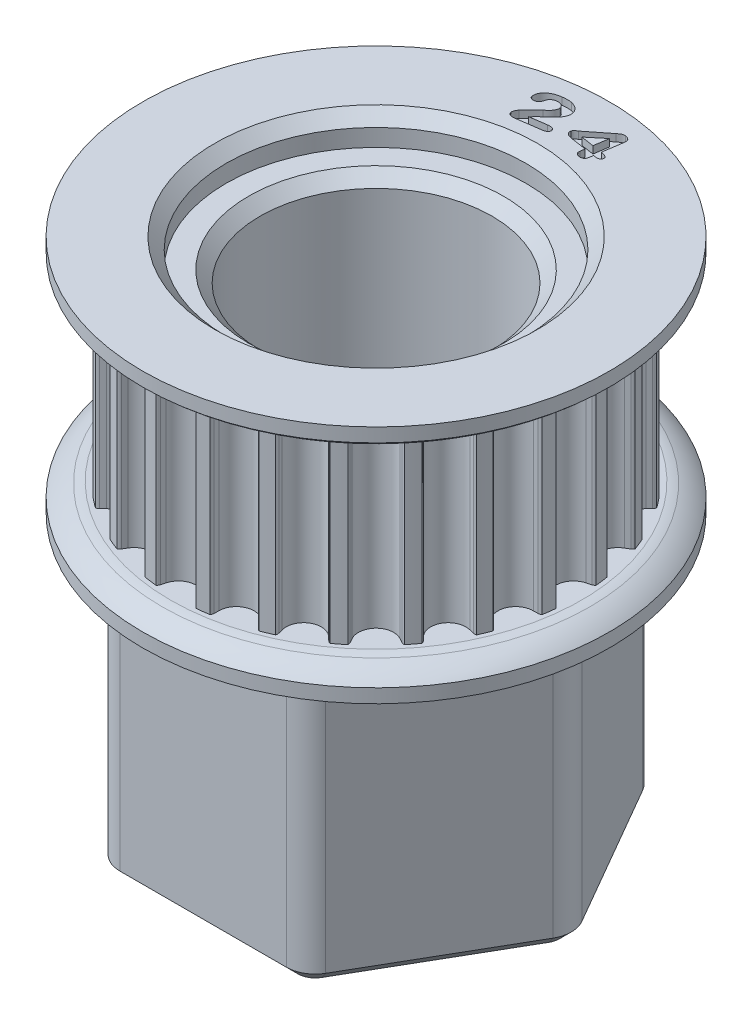
from build123d import *

# Parameters (mm, degrees)
SKETCH1_R                    = 11.078156269
TOOTHOD_DEPTH                = 5.08
TOOTHPROFILE_DEPTH           = 17.469896559
TOOTHPATTERN_COUNT           = 24
BORE_DEPTH                   = 20.343586122
BORE_DEPTH_BACK              = 20.343586122
SKETCH7_R                    = 6.3881
SMALL_TOOTH_COUNT_DEPTH      = 23.472489227
SMALL_TOOTH_COUNT_DEPTH_BACK = 0.4
SKETCH12_R                   = 6.3881
BOSS_EXTRUDE1_DEPTH          = 15.24
SKETCH27_R                   = 8.255
CUT_EXTRUDE1_DEPTH           = 1.5875
FILLET1_R                    = 1.5875
CUT_SWEEP1_PROFILE_R         = 0.3175
FILLET2_R                    = 1.27
CHAMFER1_SIZE                = 0.635
CHAMFER2_SIZE                = 0.635


with BuildPart() as part:
    # Sketch1 → ToothOD (new, symmetric)
    with BuildSketch(Plane(origin=(0, 0, 0), x_dir=(1, 0, 0), z_dir=(0, 1, 0))):
        Circle(SKETCH1_R)
    extrude(amount=TOOTHOD_DEPTH, both=True)

    # Sketch2 → ToothProfile (cut, symmetric)
    with BuildSketch(Plane(origin=(0, 0, 0), x_dir=(1, 0, 0), z_dir=(0, 1, 0))):
        with BuildLine():
            ThreePointArc((-0.937033068, 10.628218265), (-0.590385173, 10.110043655), (0, 9.909756269))
            ThreePointArc((0, 9.909756269), (0.590385173, 10.110043655), (0.937033068, 10.628218265))
            ThreePointArc((0.937033068, 10.628218265), (0.971699064, 10.754329727), (1.007805813, 10.880036269))
            ThreePointArc((1.007805813, 10.880036269), (1.043742495, 10.958436311), (1.100516181, 11.023357495))
            ThreePointArc((1.100516181, 11.023357495), (0, 11.078156269), (-1.100516181, 11.023357495))
            ThreePointArc((-1.100516181, 11.023357495), (-1.043742495, 10.958436311), (-1.007805813, 10.880036269))
            ThreePointArc((-1.007805813, 10.880036269), (-0.971699064, 10.754329727), (-0.937033068, 10.628218265))
        make_face()
    toothprofile = extrude(amount=TOOTHPROFILE_DEPTH, both=True, mode=Mode.SUBTRACT)

    # ToothPattern: ToothProfile ×24 about axis
    toothpattern_axis = Axis((0, 5.08, 0), (0, -1, 0))
    for i in range(1, TOOTHPATTERN_COUNT):
        add(toothprofile.rotate(toothpattern_axis, i * 360 / TOOTHPATTERN_COUNT), mode=Mode.SUBTRACT)

    # Sketch4 → Flange (revolve)
    with BuildSketch(Plane.XY):
        with BuildLine():
            Line((0, -5.08), (11.332156269, -5.08))
            ThreePointArc((11.332156269, -5.08), (11.56180289, -5.115951298), (11.787228598, -5.172637424))
            ThreePointArc((11.787228598, -5.172637424), (12.354957174, -5.454197125), (12.856156269, -5.842))
            Line((12.856156269, -5.842), (12.856156269, -6.604))
            Line((12.856156269, -6.604), (0, -6.604))
            Line((0, -6.604), (0, -5.08))
        make_face()
        with BuildLine():
            Line((12.856156269, 6.604), (12.856156269, 5.842))
            ThreePointArc((12.856156269, 5.842), (12.354957174, 5.454197125), (11.787228598, 5.172637424))
            ThreePointArc((11.787228598, 5.172637424), (11.56180289, 5.115951298), (11.332156269, 5.08))
            Line((11.332156269, 5.08), (0, 5.08))
            Line((0, 5.08), (0, 6.604))
            Line((0, 6.604), (12.856156269, 6.604))
        make_face()
    revolve(axis=Axis((0, 8.73125, 0), (0, -1, 0)))

    # Sketch7 → Bore (cut, two sides: drawn at the far end of the back side and taken through both)
    with BuildSketch(Plane.XZ.offset(-BORE_DEPTH_BACK)):
        Circle(SKETCH7_R)
    extrude(amount=BORE_DEPTH + BORE_DEPTH_BACK, mode=Mode.SUBTRACT)

    # Sketch11 → Small Tooth Count (cut, two sides: drawn at the far end of the back side and taken through both)
    # profile 1 of 2: a face of its own
    with BuildSketch(Plane(origin=(0, 6.604, 0), x_dir=(1, 0, 0), z_dir=(0, 1, 0)).offset(-SMALL_TOOTH_COUNT_DEPTH_BACK)):
        with BuildLine():
            Line((-1.50932721, 9.916837863), (-0.597606116, 10.046764816))
            add(Edge.make_bspline(
                [(-0.597606116, 10.046764816), (-0.571157489, 10.050105826), (-0.52120142, 10.056416311), (-0.449541333, 10.055313599), (-0.385667722, 10.047305308), (-0.330562884, 10.029277348), (-0.28444503, 10.005378402), (-0.249016623, 9.974662726), (-0.224075796, 9.938023746), (-0.217996356, 9.910169852), (-0.214969007, 9.896299582)],
                knots=[0, 0, 0, 0, 1.407436454, 2.658360686, 3.778686155, 4.796186387, 5.707822169, 6.504860125, 7.25547238, 8, 8, 8, 8], degree=3))
            add(Edge.make_bspline(
                [(-0.214969007, 9.896299582), (-0.213936308, 9.883603258), (-0.211851942, 9.857977408), (-0.222454605, 9.819456736), (-0.242047158, 9.78205115), (-0.270462476, 9.745517337), (-0.309742938, 9.712270871), (-0.360197484, 9.685833025), (-0.421026872, 9.665765439), (-0.465453114, 9.658287244), (-0.489110413, 9.654305051)],
                knots=[0, 0, 0, 0, 0.748192561, 1.510127746, 2.320859081, 3.236210595, 4.228876646, 5.33922549, 6.583118088, 8, 8, 8, 8], degree=3))
            Line((-0.489110413, 9.654305051), (-1.858031507, 9.458744894))
            add(Edge.make_bspline(
                [(-1.858031507, 9.458744894), (-1.881812164, 9.456078685), (-1.927114595, 9.450999526), (-1.992824891, 9.455151256), (-2.052190696, 9.468165459), (-2.104274077, 9.490978722), (-2.147742871, 9.521062832), (-2.181559921, 9.557126937), (-2.205078512, 9.598853341), (-2.211523929, 9.629488347), (-2.214772522, 9.644928879)],
                knots=[0, 0, 0, 0, 1.281292524, 2.440877223, 3.513557772, 4.524978182, 5.470507004, 6.329058183, 7.157818661, 8, 8, 8, 8], degree=3))
            add(Edge.make_bspline(
                [(-2.214772522, 9.644928879), (-2.215569805, 9.655797352), (-2.217301044, 9.679397428), (-2.212074679, 9.717481484), (-2.200960176, 9.760321538), (-2.184255907, 9.806310122), (-2.16419242, 9.852762198), (-2.140750929, 9.895489886), (-2.116593563, 9.93417597), (-2.097617179, 9.956478399), (-2.088417444, 9.967290597)],
                knots=[0, 0, 0, 0, 0.737310593, 1.601014737, 2.589839704, 3.735717173, 4.915099845, 6.016891089, 7.038590449, 8, 8, 8, 8], degree=3))
            add(Edge.make_bspline(
                [(-2.088417444, 9.967290597), (-2.052954712, 10.006233814), (-1.984101455, 10.081844663), (-1.882231331, 10.190148309), (-1.78600669, 10.290828012), (-1.70863357, 10.368561764), (-1.650073949, 10.425787839), (-1.610218762, 10.464524742), (-1.573038245, 10.499377239), (-1.539092018, 10.530615679), (-1.508517118, 10.558426697), (-1.480481045, 10.581976657), (-1.45629526, 10.602878662), (-1.440339068, 10.614629857), (-1.432978382, 10.620050754)],
                knots=[0, 0, 0, 0, 2.047788947, 3.975918602, 5.780698357, 7.462358793, 8.239809494, 8.964130096, 9.62319837, 10.221078995, 10.757845781, 11.229820742, 11.644711727, 12, 12, 12, 12], degree=3))
            add(Edge.make_bspline(
                [(-1.432978382, 10.620050754), (-1.411114208, 10.637295005), (-1.368791421, 10.670674943), (-1.309585205, 10.721861713), (-1.257517254, 10.773066677), (-1.210534252, 10.82242143), (-1.17028345, 10.87179307), (-1.135606303, 10.920131703), (-1.107860743, 10.968292082), (-1.08553367, 11.015174114), (-1.069936386, 11.061387106), (-1.059705317, 11.105925046), (-1.056275295, 11.149162831), (-1.058881911, 11.176977588), (-1.060163929, 11.190657785)],
                knots=[0, 0, 0, 0, 1.41082819, 2.730959837, 3.962766903, 5.109764772, 6.181493254, 7.187824709, 8.120338862, 8.994079246, 9.814383323, 10.586481619, 11.304785934, 12, 12, 12, 12], degree=3))
            add(Edge.make_bspline(
                [(-1.060163929, 11.190657785), (-1.062618629, 11.204494899), (-1.06747002, 11.231842127), (-1.083834468, 11.270115654), (-1.105489401, 11.305625195), (-1.133408735, 11.337522246), (-1.166046845, 11.366425296), (-1.203892765, 11.390361143), (-1.245966118, 11.410353932), (-1.292161897, 11.424992006), (-1.340996369, 11.435882109), (-1.391906039, 11.441117217), (-1.44430733, 11.441309423), (-1.479439833, 11.437047814), (-1.497272132, 11.434884738)],
                knots=[0, 0, 0, 0, 0.906920493, 1.792408525, 2.674642041, 3.589913914, 4.525093507, 5.487027952, 6.478087552, 7.532080477, 8.616620183, 9.711251621, 10.838293888, 12, 12, 12, 12], degree=3))
            add(Edge.make_bspline(
                [(-1.497272132, 11.434884738), (-1.514165051, 11.431956836), (-1.547305706, 11.426212856), (-1.594999107, 11.41181417), (-1.63941231, 11.392475804), (-1.680884552, 11.368710631), (-1.719132889, 11.340057857), (-1.753507144, 11.305976261), (-1.785597804, 11.268097526), (-1.803721896, 11.239846839), (-1.812936585, 11.225483566)],
                knots=[0, 0, 0, 0, 1.047578806, 2.055147905, 3.037331254, 4.003491932, 4.971707363, 5.949835577, 6.957651196, 8, 8, 8, 8], degree=3))
            add(Edge.make_bspline(
                [(-1.812936585, 11.225483566), (-1.814458795, 11.221775606), (-1.819020173, 11.210664523), (-1.826430513, 11.187392943), (-1.8363605, 11.151981445), (-1.848825896, 11.106904921), (-1.864197864, 11.057785769), (-1.883498509, 11.010024351), (-1.907843305, 10.967140907), (-1.933918105, 10.926754831), (-1.968424595, 10.891810149), (-2.013254557, 10.864955698), (-2.067652355, 10.844897277), (-2.107752263, 10.83772542), (-2.129047522, 10.833916769)],
                knots=[0, 0, 0, 0, 0.265007539, 0.794108009, 1.613373207, 2.697617163, 3.886602221, 5.01617726, 6.095451393, 7.143719409, 8.187635248, 9.310199435, 10.571567743, 12, 12, 12, 12], degree=3))
            add(Edge.make_bspline(
                [(-2.129047522, 10.833916769), (-2.145702833, 10.832148904), (-2.177842142, 10.828737501), (-2.225347998, 10.833205546), (-2.269895483, 10.844047702), (-2.310724724, 10.862888812), (-2.346516666, 10.888526805), (-2.374439978, 10.921981153), (-2.393798514, 10.962258671), (-2.399679354, 10.991777532), (-2.402742444, 11.007152707)],
                knots=[0, 0, 0, 0, 1.103853878, 2.130077396, 3.133877759, 4.119166359, 5.082634088, 6.017851916, 6.96757965, 8, 8, 8, 8], degree=3))
            add(Edge.make_bspline(
                [(-2.402742444, 11.007152707), (-2.404621818, 11.025443769), (-2.408440344, 11.062607704), (-2.404036406, 11.119951061), (-2.393382933, 11.179126415), (-2.374872021, 11.239758118), (-2.349177564, 11.300687215), (-2.315494278, 11.36032443), (-2.273763975, 11.417744069), (-2.225138897, 11.473717212), (-2.168189831, 11.527075519), (-2.102387044, 11.576589749), (-2.02866634, 11.622983283), (-1.946451016, 11.665537987), (-1.855893746, 11.703375453), (-1.756635021, 11.735560403), (-1.648939306, 11.761335845), (-1.573863538, 11.773374554), (-1.535223304, 11.779570676)],
                knots=[0, 0, 0, 0, 0.686667313, 1.395176401, 2.14217196, 2.933050997, 3.761378171, 4.611517609, 5.489179995, 6.412591937, 7.381608954, 8.40276096, 9.488705709, 10.636721208, 11.862062126, 13.156195851, 14.536341884, 16, 16, 16, 16], degree=3))
            add(Edge.make_bspline(
                [(-1.535223304, 11.779570676), (-1.51098446, 11.782864739), (-1.463484936, 11.789319934), (-1.3931866, 11.795965108), (-1.325279482, 11.800104771), (-1.259746788, 11.801309567), (-1.196738069, 11.800639843), (-1.136249357, 11.797045796), (-1.078284928, 11.79091863), (-1.0406437, 11.784799376), (-1.022212757, 11.781803097)],
                knots=[0, 0, 0, 0, 1.139510729, 2.233036297, 3.288782861, 4.308228055, 5.285958018, 6.223630361, 7.130204615, 8, 8, 8, 8], degree=3))
            add(Edge.make_bspline(
                [(-1.022212757, 11.781803097), (-0.996346238, 11.776001966), (-0.945668387, 11.764636353), (-0.873068597, 11.740276391), (-0.805417719, 11.710781694), (-0.742751011, 11.676450968), (-0.685656039, 11.637533154), (-0.633786844, 11.595223091), (-0.58870652, 11.54841819), (-0.54906255, 11.498825501), (-0.516177347, 11.446357641), (-0.489829112, 11.391805019), (-0.470755505, 11.33520861), (-0.463644085, 11.296287026), (-0.460088929, 11.276829269)],
                knots=[0, 0, 0, 0, 1.184878925, 2.321422417, 3.418236948, 4.481667666, 5.511750754, 6.504540555, 7.469430236, 8.412213537, 9.339242204, 10.232319117, 11.116297388, 12, 12, 12, 12], degree=3))
            add(Edge.make_bspline(
                [(-0.460088929, 11.276829269), (-0.458344915, 11.26151817), (-0.454881571, 11.231112681), (-0.454228176, 11.185416025), (-0.456587369, 11.139957574), (-0.463987312, 11.095046809), (-0.474807198, 11.050442291), (-0.489144725, 11.006067202), (-0.507281058, 10.961900847), (-0.537254061, 10.905276357), (-0.576759476, 10.838655761), (-0.626292967, 10.765363592), (-0.676992982, 10.701276091), (-0.722071621, 10.653855546), (-0.761194236, 10.617845627), (-0.794206933, 10.586849676), (-0.832065984, 10.552066211), (-0.87505434, 10.51382363), (-0.922365044, 10.471389469), (-0.974062376, 10.42482995), (-1.030912184, 10.37483785), (-1.091062336, 10.322368683), (-1.150688874, 10.269172522), (-1.207256163, 10.218149043), (-1.258914453, 10.170234867), (-1.305402401, 10.125022937), (-1.347010294, 10.083115848), (-1.383776929, 10.044108725), (-1.415868177, 10.008409704), (-1.434851705, 9.9849262), (-1.443694007, 9.973987863)],
                knots=[0, 0, 0, 0, 0.764715832, 1.518608056, 2.266281531, 3.021946302, 3.774714963, 4.543561344, 5.335395795, 6.141819471, 7.722191955, 9.179477286, 10.530900026, 11.774914819, 12.423188144, 13.170861619, 14.023369367, 14.975807079, 16.027662526, 17.178935749, 18.430237895, 19.786500845, 21.142119432, 22.397756293, 23.568968093, 24.640267795, 25.617411505, 26.500872375, 27.301724132, 28, 28, 28, 28], degree=3))
            add(Edge.make_bspline(
                [(-1.443694007, 9.973987863), (-1.453364212, 9.963671779), (-1.47330175, 9.942402602), (-1.497081325, 9.925527908), (-1.50932721, 9.916837863)],
                knots=[0, 0, 0, 0, 0.970050127, 2, 2, 2, 2], degree=3))
        make_face()
    # profile 2 of 2: a face of its own
    with BuildSketch(Plane(origin=(0, 6.604, 0), x_dir=(1, 0, 0), z_dir=(0, 1, 0)).offset(-SMALL_TOOTH_COUNT_DEPTH_BACK)):
        with BuildLine():
            Line((1.54875845, 9.694357822), (1.584923685, 9.933226963))
            Line((1.584923685, 9.933226963), (0.682132279, 10.069851181))
            add(Edge.make_bspline(
                [(0.682132279, 10.069851181), (0.667069888, 10.072365675), (0.637833552, 10.077246347), (0.59577177, 10.087058213), (0.55695217, 10.098786908), (0.52087805, 10.111393675), (0.488418367, 10.126838621), (0.458477124, 10.143111023), (0.432269492, 10.162056812), (0.408693626, 10.18212698), (0.38870757, 10.203944717), (0.371885868, 10.226994313), (0.35840571, 10.251290566), (0.348018344, 10.276733106), (0.341320451, 10.303508094), (0.337827643, 10.331370309), (0.337171075, 10.360614092), (0.339714529, 10.380324227), (0.341018216, 10.390426963)],
                knots=[0, 0, 0, 0, 1.388781889, 2.695647554, 3.924835582, 5.076755441, 6.166884665, 7.191145902, 8.171528826, 9.102438726, 10.003031995, 10.85597153, 11.692204285, 12.524262991, 13.348354993, 14.194608087, 15.074618352, 16, 16, 16, 16], degree=3))
            add(Edge.make_bspline(
                [(0.341018216, 10.390426963), (0.343314029, 10.401766071), (0.347905655, 10.424444287), (0.364951704, 10.456369439), (0.388568217, 10.486709873), (0.418275625, 10.515685703), (0.450792773, 10.54325826), (0.483165479, 10.570045891), (0.516726241, 10.593594233), (0.541010266, 10.605208787), (0.553098294, 10.610990244)],
                knots=[0, 0, 0, 0, 0.874989528, 1.749979056, 2.718094681, 3.789673942, 4.896134263, 5.957640263, 6.983360329, 8, 8, 8, 8], degree=3))
            Line((0.553098294, 10.610990244), (1.705027982, 11.518692978))
            add(Edge.make_bspline(
                [(1.705027982, 11.518692978), (1.723363136, 11.532991398), (1.757949305, 11.559962949), (1.808225363, 11.595384396), (1.852746903, 11.624819107), (1.892637113, 11.648787092), (1.932025804, 11.666045934), (1.973483961, 11.675129197), (2.017493428, 11.678705146), (2.047351945, 11.6750505), (2.062661966, 11.673176572)],
                knots=[0, 0, 0, 0, 1.385215562, 2.61297499, 3.66319543, 4.565137817, 5.383713486, 6.211887483, 7.083141318, 8, 8, 8, 8], degree=3))
            add(Edge.make_bspline(
                [(2.062661966, 11.673176572), (2.076257006, 11.671040484), (2.102449413, 11.666925065), (2.139810345, 11.656941366), (2.174575329, 11.646872817), (2.206120926, 11.633628939), (2.234672364, 11.618826973), (2.260956403, 11.602999155), (2.283731023, 11.58450638), (2.303810023, 11.564346874), (2.320102009, 11.541778551), (2.334314126, 11.518050763), (2.345011256, 11.492131061), (2.353022598, 11.464600848), (2.358015704, 11.435084984), (2.359498037, 11.403817064), (2.358831026, 11.370632185), (2.355784412, 11.348116563), (2.354216263, 11.336527353)],
                knots=[0, 0, 0, 0, 1.293804893, 2.49266397, 3.63541932, 4.696405976, 5.704707744, 6.66060036, 7.576904144, 8.458193591, 9.329188293, 10.188967274, 11.054995144, 11.959019234, 12.88214529, 13.86394316, 14.900531759, 16, 16, 16, 16], degree=3))
            Line((2.354216263, 11.336527353), (2.1845522, 10.222102353))
            Line((2.1845522, 10.222102353), (2.207322904, 10.218530478))
            add(Edge.make_bspline(
                [(2.207322904, 10.218530478), (2.232248392, 10.214268879), (2.280202022, 10.206070076), (2.348269361, 10.188595146), (2.409795368, 10.167787516), (2.456229433, 10.147023934), (2.48888784, 10.127893843), (2.509196551, 10.111682906), (2.526056243, 10.093814855), (2.538824571, 10.073635644), (2.547904264, 10.051594759), (2.552635086, 10.027515392), (2.554062763, 10.001786493), (2.552120748, 9.984263558), (2.551115872, 9.975196494)],
                knots=[0, 0, 0, 0, 1.927642278, 3.708550971, 5.352300247, 6.875759797, 7.578383738, 8.232399134, 8.850783688, 9.442669577, 10.04330382, 10.657613479, 11.305395775, 12, 12, 12, 12], degree=3))
            add(Edge.make_bspline(
                [(2.551115872, 9.975196494), (2.547955126, 9.96102685), (2.541797823, 9.933423624), (2.517793864, 9.897447274), (2.483869765, 9.869057778), (2.439811976, 9.848735526), (2.387159558, 9.83647943), (2.326366538, 9.831010515), (2.257659441, 9.832569738), (2.209510712, 9.838837208), (2.184105716, 9.84214415)],
                knots=[0, 0, 0, 0, 0.796932365, 1.552466999, 2.340640896, 3.216672216, 4.208643632, 5.316555866, 6.584118596, 8, 8, 8, 8], degree=3))
            Line((2.184105716, 9.84214415), (2.127848685, 9.850627353))
            Line((2.127848685, 9.850627353), (2.09168345, 9.611758213))
            add(Edge.make_bspline(
                [(2.09168345, 9.611758213), (2.087915831, 9.593695487), (2.080686946, 9.559038758), (2.05877288, 9.511463546), (2.027421046, 9.471942372), (1.987626923, 9.440800936), (1.941248649, 9.417609853), (1.888057705, 9.405099886), (1.829490591, 9.400928089), (1.789087064, 9.405679459), (1.767982279, 9.408161338)],
                knots=[0, 0, 0, 0, 1.023598687, 1.96396612, 2.882860389, 3.801754658, 4.752874875, 5.742353606, 6.820718238, 8, 8, 8, 8], degree=3))
            add(Edge.make_bspline(
                [(1.767982279, 9.408161338), (1.749936329, 9.411515451), (1.715051993, 9.417999234), (1.667376192, 9.438251786), (1.625447447, 9.464339438), (1.590867277, 9.497992309), (1.564133216, 9.53845956), (1.54803808, 9.585677285), (1.542213237, 9.638713459), (1.54650315, 9.675184309), (1.54875845, 9.694357822)],
                knots=[0, 0, 0, 0, 1.075850784, 2.079709954, 3.02358972, 3.963774271, 4.892949688, 5.847308372, 6.868283553, 8, 8, 8, 8], degree=3))
        make_face()
        Polygon((0.929484622, 10.412751181), (1.6416272, 10.304701963), (1.763517435, 11.104801963), align=None, mode=Mode.SUBTRACT)
    extrude(amount=SMALL_TOOTH_COUNT_DEPTH + SMALL_TOOTH_COUNT_DEPTH_BACK, mode=Mode.SUBTRACT)

    # Sketch12 → Boss-Extrude1 (add)
    with BuildSketch(Plane.XZ.offset(6.604)):
        Polygon((5.499261314, -9.525), (10.998522628, 0), (5.499261314, 9.525), (-5.499261314, 9.525), (-10.998522628, 0), (-5.499261314, -9.525), align=None)
        Circle(SKETCH12_R, mode=Mode.SUBTRACT)
    extrude(amount=BOSS_EXTRUDE1_DEPTH)

    # Sketch27 → Cut-Extrude1 (cut)
    with BuildSketch(Plane(origin=(0, 6.604, 0), x_dir=(1, 0, 0), z_dir=(0, 1, 0))):
        Circle(SKETCH27_R)
    extrude(amount=-CUT_EXTRUDE1_DEPTH, mode=Mode.SUBTRACT)

    # Fillet1
    fillet1_edges = [part.edges().sort_by_distance(p)[0] for p in [
        (-5.499261314, -14.224, 9.525),
        (5.499261314, -14.224, 9.525),
        (10.998522628, -14.224, 0),
        (5.499261314, -14.224, -9.525),
        (-10.998522628, -14.224, 0),
        (-5.499261314, -14.224, -9.525),
    ]]
    fillet(fillet1_edges, radius=FILLET1_R)

    # Cut-Sweep1: sweep along a path in Sketch25
    with BuildLine(Plane.XZ.offset(6.604)) as cut_sweep1_path:
        Line((-4.582717762, -9.525), (4.582717762, -9.525))
        ThreePointArc((4.582717762, -9.525), (5.376467762, -9.312315329), (5.95753309, -8.73125))
        Line((5.95753309, -8.73125), (10.540250852, -0.79375))
        ThreePointArc((10.540250852, -0.79375), (10.752935523, 0), (10.540250852, 0.79375))
        Line((10.540250852, 0.79375), (5.95753309, 8.73125))
        ThreePointArc((5.95753309, 8.73125), (5.376467762, 9.312315329), (4.582717762, 9.525))
        Line((4.582717762, 9.525), (-4.582717762, 9.525))
        ThreePointArc((-4.582717762, 9.525), (-5.376467762, 9.312315329), (-5.95753309, 8.73125))
        Line((-5.95753309, 8.73125), (-10.540250852, 0.79375))
        ThreePointArc((-10.540250852, 0.79375), (-10.752935523, 0), (-10.540250852, -0.79375))
        Line((-10.540250852, -0.79375), (-5.95753309, -8.73125))
        ThreePointArc((-5.95753309, -8.73125), (-5.376467762, -9.312315329), (-4.582717762, -9.525))
    # Cut-Sweep1 profile (on start of the path) → Cut-Sweep1 (sweep, cut)
    with BuildSketch(Plane(origin=(-4.582717762, -6.604, -9.525), x_dir=(0, 0, 1), z_dir=(1, 0, 0))):
        Circle(CUT_SWEEP1_PROFILE_R)
    sweep(path=cut_sweep1_path.line, mode=Mode.SUBTRACT)

    # Fillet2
    fillet2_edges = [part.edges().sort_by_distance(p)[0] for p in [
        (-5.535217762, -6.604, 9.587278394),
        (0, -6.604, 9.8425),
        (5.535217762, -6.604, 9.587278394),
        (8.523855037, -6.604, 4.92125),
        (11.070435523, -6.604, 0),
        (8.523855037, -6.604, -4.92125),
        (5.535217762, -6.604, -9.587278394),
        (0, -6.604, -9.8425),
        (-5.535217762, -6.604, -9.587278394),
        (-8.523855037, -6.604, -4.92125),
        (-11.070435523, -6.604, 0),
        (-10.752935523, -6.9215, 0),
        (-8.248891971, -6.9215, -4.7625),
        (-5.376467762, -6.9215, -9.312315329),
        (0, -6.9215, -9.525),
        (5.376467762, -6.9215, -9.312315329),
        (8.248891971, -6.9215, -4.7625),
        (10.752935523, -6.9215, 0),
        (8.248891971, -6.9215, 4.7625),
        (5.376467762, -6.9215, 9.312315329),
        (0, -6.9215, 9.525),
        (-5.376467762, -6.9215, 9.312315329),
        (-8.523855037, -6.604, 4.92125),
        (-8.248891971, -6.9215, 4.7625),
    ]]
    fillet(fillet2_edges, radius=FILLET2_R)

    # Chamfer1
    chamfer1_edges = [part.edges().sort_by_distance(p)[0] for p in [
        (-6.3881, -21.844, 0),
        (-8.255, 6.604, 0),
        (-6.3881, 5.0165, 0),
    ]]
    chamfer(chamfer1_edges, length=CHAMFER1_SIZE)

    # Chamfer2
    chamfer2_edges = [part.edges().sort_by_distance(p)[0] for p in [
        (0, -21.844, -9.525),
        (5.376467762, -21.844, -9.312315329),
        (-5.376467762, -21.844, -9.312315329),
        (8.248891971, -21.844, -4.7625),
        (-8.248891971, -21.844, -4.7625),
        (10.752935523, -21.844, 0),
        (-10.752935523, -21.844, 0),
        (8.248891971, -21.844, 4.7625),
        (-8.248891971, -21.844, 4.7625),
        (5.376467762, -21.844, 9.312315329),
        (-5.376467762, -21.844, 9.312315329),
        (0, -21.844, 9.525),
    ]]
    chamfer(chamfer2_edges, length=CHAMFER2_SIZE)


solid = part.part
